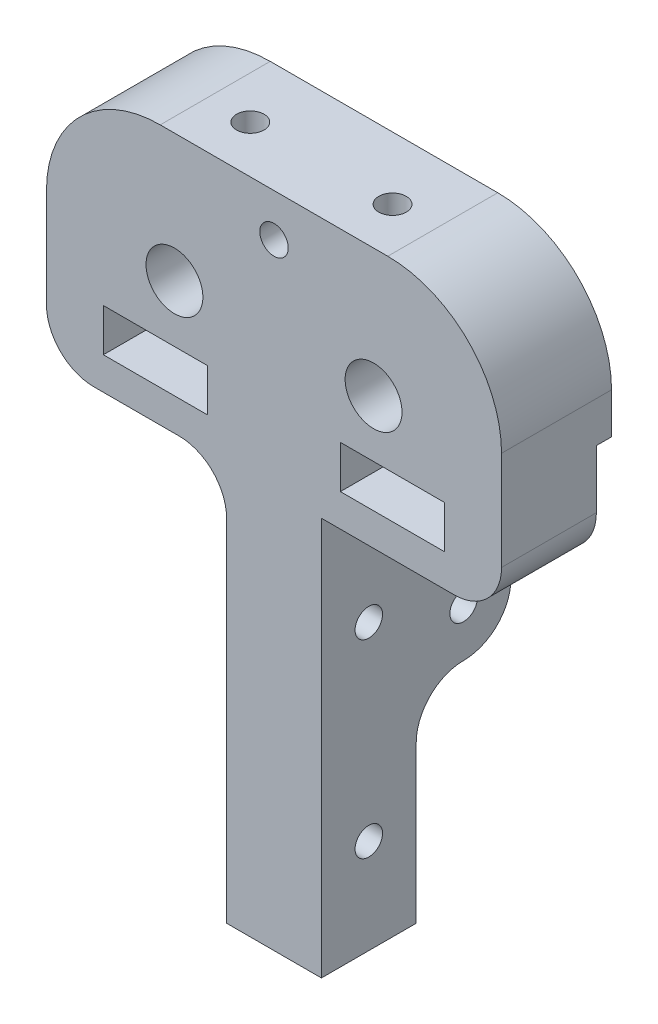
from build123d import *

# Parameters (mm, degrees)
SKETCH1_W               = 48
SKETCH1_H               = 70
BOSS_EXTRUDE1_DEPTH     = 10
SKETCH2_R               = 3
CUT_EXTRUDE1_DEPTH      = 86.463442477
SKETCH3_W               = 20.6
SKETCH3_H               = 20.6
CUT_EXTRUDE2_DEPTH      = 86.463442477
FILLET1_R               = 12
SKETCH4_R               = 1.5
CUT_EXTRUDE3_DEPTH      = 86.463442477
SKETCH5_R               = 1.45
CUT_EXTRUDE4_DEPTH      = 10
CUT_EXTRUDE5_DEPTH      = 86.463442477
CUT_EXTRUDE5_DEPTH_BACK = 86.463442477
SKETCH7_W               = 11
SKETCH7_H               = 4.5
SKETCH11_W              = 32
SKETCH11_H              = 15
CUT_EXTRUDE6_DEPTH      = 86.463442477
CUT_EXTRUDE7_DEPTH      = 8
CUT_EXTRUDE7_DEPTH_BACK = 5
SKETCH12_R              = 1.5
SKETCH13_R              = 1.5
BOSS_EXTRUDE4_DEPTH     = 1.6
FILLET2_R               = 8
SKETCH14_W              = 48
SKETCH14_H              = 42.571441548
CUT_EXTRUDE8_DEPTH      = 86.665395594
SKETCH15_W              = 10
SKETCH15_H              = 10
BOSS_EXTRUDE5_DEPTH     = 42
SKETCH18_W              = 10
SKETCH18_H              = 10
BOSS_EXTRUDE8_DEPTH     = 10
SKETCH19_R              = 1.45
CUT_EXTRUDE9_DEPTH      = 76.903390772
FILLET3_R               = 5
FILLET4_R               = 5
FILLET5_R               = 2


# Some blends are built 0.0001 mm under size
with BuildPart() as part:
    # Sketch1 → Boss-Extrude1 (new body)
    with BuildSketch(Plane.XY):
        with Locations((24, -35)):
            Rectangle(SKETCH1_W, SKETCH1_H)
    extrude(amount=BOSS_EXTRUDE1_DEPTH)

    # Sketch2 → Cut-Extrude1 (cut, through all)
    with BuildSketch(Plane.XY.offset(10)):
        with Locations((13.5, -13.5)):
            Circle(SKETCH2_R)
        with Locations((34.5, -13.5)):
            Circle(SKETCH2_R)
    extrude(amount=-CUT_EXTRUDE1_DEPTH, mode=Mode.SUBTRACT)

    # Sketch3 → Cut-Extrude2 (cut, through all)
    with BuildSketch(Plane.XY.offset(10)):
        with Locations((24, -48.8)):
            Rectangle(SKETCH3_W, SKETCH3_H)
    extrude(amount=-CUT_EXTRUDE2_DEPTH, mode=Mode.SUBTRACT)

    # Fillet1
    fillet1_edges = [part.edges().sort_by_distance(p)[0] for p in [
        (0, 0, 5),
        (48, 0, 5),
    ]]
    fillet(fillet1_edges, radius=FILLET1_R)

    # Sketch4 → Cut-Extrude3 (cut, through all)
    with BuildSketch(Plane(origin=(0, 0, 0), x_dir=(-1, 0, 0), z_dir=(0, 0, -1))):
        with Locations((-24, -4.5)):
            Circle(SKETCH4_R)
    extrude(amount=-CUT_EXTRUDE3_DEPTH, mode=Mode.SUBTRACT)

    # Sketch5 → Cut-Extrude4 (cut)
    with BuildSketch(Plane(origin=(0, 0, 0), x_dir=(1, 0, 0), z_dir=(0, 1, 0))):
        with Locations(Location((16.5, -5, 0), (0, 0, 270))):
            Circle(SKETCH5_R)
        with Locations(Location((31.5, -5, 0), (0, 0, 270))):
            Circle(SKETCH5_R)
    extrude(amount=-CUT_EXTRUDE4_DEPTH, mode=Mode.SUBTRACT)

    # Sketch7 → Cut-Extrude5 (cut, two sides: drawn at the far end of the back side and taken through both)
    with BuildSketch(Plane(origin=(0, 0, 0), x_dir=(-1, 0, 0), z_dir=(0, 0, -1)).offset(-CUT_EXTRUDE5_DEPTH_BACK)):
        with Locations((-36.5, -21.75)):
            Rectangle(SKETCH7_W, SKETCH7_H)
        with Locations((-11.5, -21.75)):
            Rectangle(SKETCH7_W, SKETCH7_H)
    extrude(amount=CUT_EXTRUDE5_DEPTH + CUT_EXTRUDE5_DEPTH_BACK, mode=Mode.SUBTRACT)

    # Sketch11 → Cut-Extrude6 (cut, through all)
    with BuildSketch(Plane(origin=(0, 0, 0), x_dir=(-1, 0, 0), z_dir=(0, 0, -1))):
        with Locations((-24, -35)):
            Rectangle(SKETCH11_W, SKETCH11_H)
    extrude(amount=-CUT_EXTRUDE6_DEPTH, mode=Mode.SUBTRACT)

    # Sketch12 → Cut-Extrude7 (cut, two sides: drawn at the far end of the back side and taken through both)
    with BuildSketch(Plane(origin=(0, -24, 0), x_dir=(1, 0, 0), z_dir=(0, 1, 0)).offset(-CUT_EXTRUDE7_DEPTH_BACK)):
        with Locations(Location((36.5, -3, 0), (0, 0, 90))):
            Circle(SKETCH12_R)
        with Locations((11.5, -3)):
            Circle(SKETCH12_R)
    extrude(amount=CUT_EXTRUDE7_DEPTH + CUT_EXTRUDE7_DEPTH_BACK, mode=Mode.SUBTRACT)

    # Sketch13 → Boss-Extrude4 (add)
    with BuildSketch(Plane(origin=(0, 0, 0), x_dir=(-1, 0, 0), z_dir=(0, 0, -1))):
        with BuildLine():
            Line((-48, -12), (-48, -16.3))
            Line((-48, -16.3), (-35.577032961, -16.3))
            ThreePointArc((-35.577032961, -16.3), (-36.198367027, -11.027036304), (-31.5, -13.5))
            ThreePointArc((-31.5, -13.5), (-32.027036304, -15.198367027), (-33.422967039, -16.3))
            Line((-33.422967039, -16.3), (-14.577032961, -16.3))
            ThreePointArc((-14.577032961, -16.3), (-15.198367027, -11.027036304), (-10.5, -13.5))
            ThreePointArc((-10.5, -13.5), (-11.027036304, -15.198367027), (-12.422967039, -16.3))
            Line((-12.422967039, -16.3), (0, -16.3))
            Line((0, -16.3), (0, -12))
            ThreePointArc((0, -12), (-3.514718626, -3.514718626), (-12, 0))
            Line((-12, 0), (-36, 0))
            ThreePointArc((-36, 0), (-44.485281374, -3.514718626), (-48, -12))
        make_face()
        with Locations((-24, -4.5)):
            Circle(SKETCH13_R, mode=Mode.SUBTRACT)
    extrude(amount=BOSS_EXTRUDE4_DEPTH)

    # Fillet2
    # the kernel refuses this fillet: 8 mm, written as the material it takes off along each edge
    with BuildSketch(Plane(origin=(13.7, -42.5, -19.155612754), x_dir=(-1, 0, 0), z_dir=(0, 0, 1))) as fillet2_piece_1:
        with BuildLine():
            CenterArc((8, 7.662245102), FILLET2_R, 180, 73.291656284)
            Line((0, 7.662245102), (-0.16, 7.662245102))
            Line((-0.16, 7.662245102), (-0.16, 0))
            Line((-0.16, 0), (0, -0.16))
            ThreePointArc((0, -0.16), (2.85, -0.16), (5.654, -0.153244902))
            Line((5.654, -0.153244902), (5.7, 0))
        make_face()
    extrude(amount=48.311225509, mode=Mode.SUBTRACT)
    with BuildSketch(Plane(origin=(34.3, -42.5, 29.155612754), x_dir=(0, -1, 0), z_dir=(0, 0, -1))) as fillet2_piece_2:
        with BuildLine():
            CenterArc((7.662245102, -8), FILLET2_R, 90, 73.291656284)
            Line((0, -5.7), (-0.153244902, -5.654))
            ThreePointArc((-0.153244902, -5.654), (-0.16, -2.85), (-0.16, 0))
            Line((-0.16, 0), (0, 0.16))
            Line((0, 0.16), (7.662245102, 0.16))
            Line((7.662245102, 0.16), (7.662245102, 0))
        make_face()
    extrude(amount=48.311225509, mode=Mode.SUBTRACT)

    # Sketch14 → Cut-Extrude8 (cut, through all)
    with BuildSketch(Plane.XY.offset(10)):
        with Locations((24, -48.714279226)):
            Rectangle(SKETCH14_W, SKETCH14_H)
    extrude(amount=-CUT_EXTRUDE8_DEPTH, mode=Mode.SUBTRACT)

    # Sketch15 → Boss-Extrude5 (add)
    with BuildSketch(Plane(origin=(0, -27.428558452, 0), x_dir=(-1, 0, 0), z_dir=(0, -1, 0))):
        with Locations((-24, -5)):
            Rectangle(SKETCH15_W, SKETCH15_H)
    extrude(amount=BOSS_EXTRUDE5_DEPTH)

    # Sketch18 → Boss-Extrude8 (add)
    with BuildSketch(Plane(origin=(0, 0, 0), x_dir=(-1, 0, 0), z_dir=(0, 0, -1))):
        with Locations((-24, -42.928558452)):
            Rectangle(SKETCH18_W, SKETCH18_H)
    extrude(amount=BOSS_EXTRUDE8_DEPTH)

    # Sketch19 → Cut-Extrude9 (cut, through all)
    with BuildSketch(Plane(origin=(29, 0, 0), x_dir=(0, 0, -1), z_dir=(1, 0, 0))):
        with Locations((5, -42.928558452)):
            Circle(SKETCH19_R)
        with Locations((-5, -59.428558452)):
            Circle(SKETCH19_R)
        with Locations((-5, -39.428558452)):
            Circle(SKETCH19_R)
    extrude(amount=-CUT_EXTRUDE9_DEPTH, mode=Mode.SUBTRACT)

    # Fillet3
    fillet3_edges = [part.edges().sort_by_distance(p)[0] for p in [
        (48, -27.428558452, 5),
        (0, -27.428558452, 5),
        (19, -27.428558452, 5),
    ]]
    fillet(fillet3_edges, radius=FILLET3_R)

    # Fillet4
    fillet4_edges = [part.edges().sort_by_distance(p)[0] for p in [
        (24, -47.928558452, 0),
        (24, -47.928558452, -10),
        (24, -37.928558452, -10),
    ]]
    fillet(fillet4_edges, radius=FILLET4_R - 0.0001)  # a hair under: the kernel refuses the full size

    # Fillet5
    fillet5_edges = [part.edges().sort_by_distance(p)[0] for p in [
        (24, -37.928558452, 0),
    ]]
    fillet(fillet5_edges, radius=FILLET5_R)


solid = part.part
